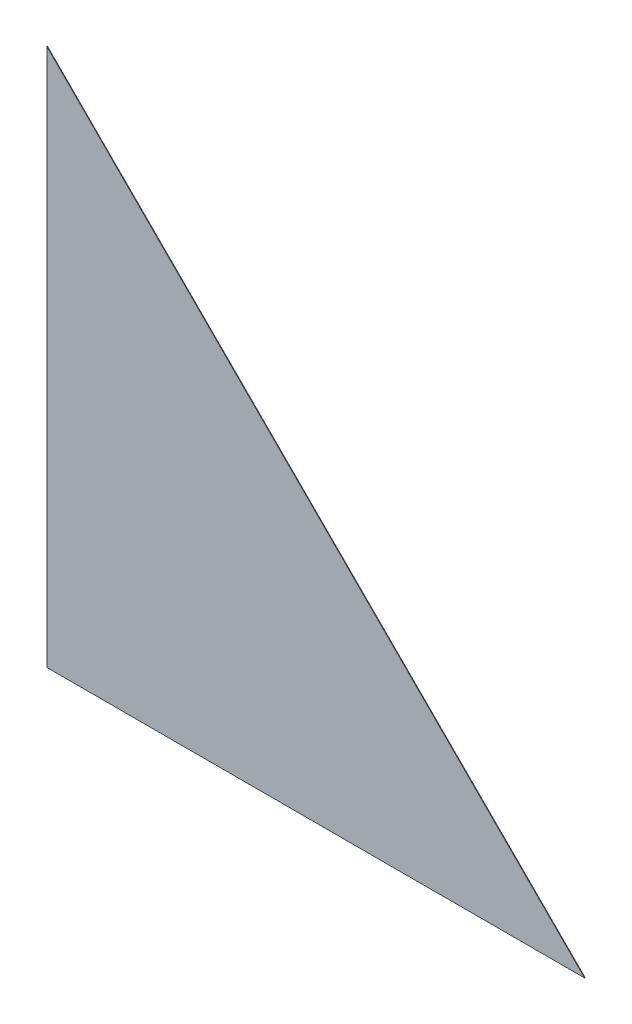
from build123d import *

# Parameters (mm, degrees)
BOSS_EXTRUDE1_DEPTH = 1.5875


with BuildPart() as part:
    # Sketch1 → Boss-Extrude1 (new body)
    with BuildSketch(Plane.XY):
        Polygon((0, 1491.081843199), (0, -32.918156801), (1524, -32.918156801), align=None)
    extrude(amount=BOSS_EXTRUDE1_DEPTH)


solid = part.part
